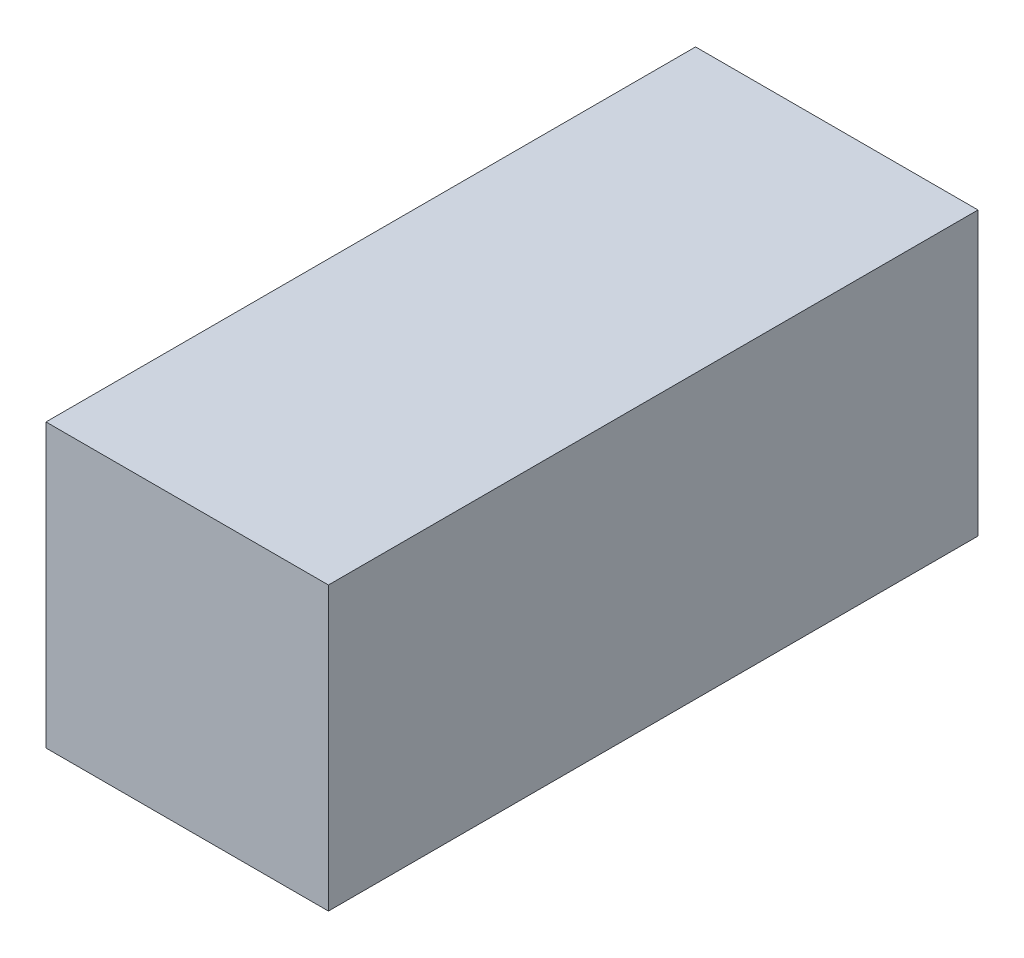
from build123d import *

# Parameters (mm, degrees)
SKETCH1_W           = 100
SKETCH1_H           = 100
BOSS_EXTRUDE1_DEPTH = 230


with BuildPart() as part:
    # Sketch1 → Boss-Extrude1 (new body)
    with BuildSketch(Plane.XY):
        Rectangle(SKETCH1_W, SKETCH1_H)
    extrude(amount=BOSS_EXTRUDE1_DEPTH)


solid = part.part
